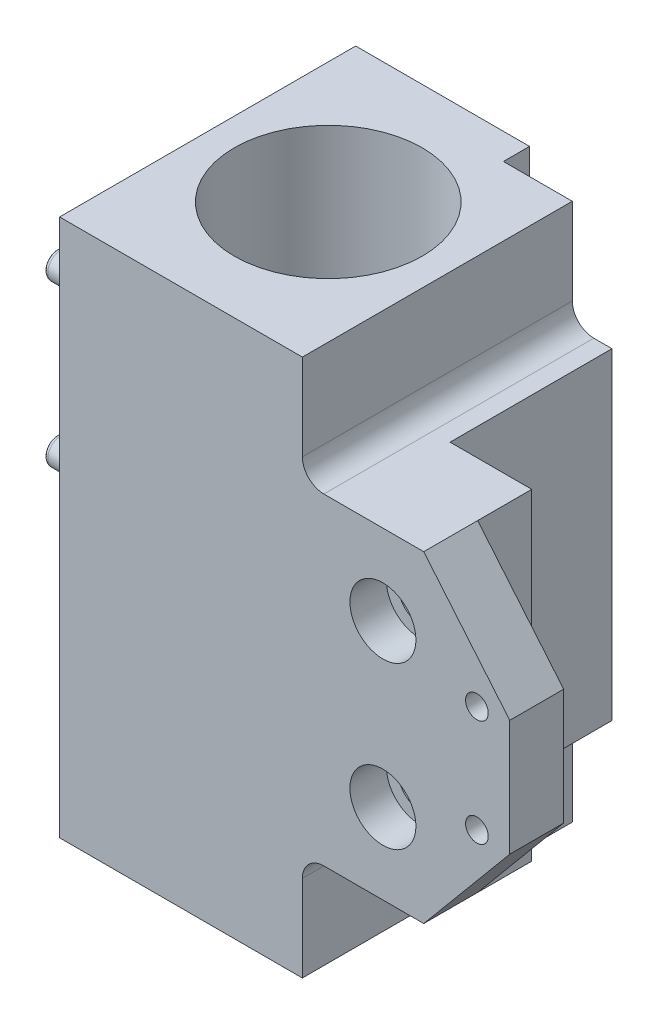
from build123d import *

# Parameters (mm, degrees)
BOSS_EXTRUDE1_DEPTH      = 31.765
BOSS_EXTRUDE1_DEPTH_BACK = 31.765
SKETCH1_R                = 11.1
SKETCH2_W                = 12.73
SKETCH2_H                = 38.12
BOSS_EXTRUDE2_DEPTH      = 9.43
CUT_EXTRUDE1_DEPTH       = 62.165032698
CHAMFER1_SIZE            = 1.6
SKETCH4_R                = 1.41
CUT_EXTRUDE2_DEPTH       = 11
SKETCH5_R                = 2.445
CUT_EXTRUDE3_DEPTH       = 55.875215034
SKETCH6_R                = 3.9
CUT_EXTRUDE4_DEPTH       = 4.32
SKETCH7_R                = 1.34
CUT_EXTRUDE5_DEPTH       = 58.75892074
SKETCH8_R                = 2
CUT_EXTRUDE6_DEPTH       = 10.5
SKETCH9_R                = 1.57
BOSS_EXTRUDE3_DEPTH      = 8.3
FILLET1_R                = 0.5


with BuildPart() as part:
    # Sketch1 → Boss-Extrude1 (new, two sides: drawn at the far end of the back side and taken through both)
    with BuildSketch(Plane(origin=(0, 0, 0), x_dir=(1, 0, 0), z_dir=(0, 1, 0)).offset(-BOSS_EXTRUDE1_DEPTH_BACK)):
        Polygon((-14.34, 17.58), (-14.34, -17.4), (38.84, -17.4), (38.84, -11.03), (28.68, -11.03), (28.68, -4.64), (19.03, -4.64), (19.03, 14.49), (14.34, 14.49), (6.2, 14.49), (6.2, 17.58), align=None)
        Circle(SKETCH1_R, mode=Mode.SUBTRACT)
    extrude(amount=BOSS_EXTRUDE1_DEPTH + BOSS_EXTRUDE1_DEPTH_BACK)

    # Sketch2 → Boss-Extrude2 (add)
    with BuildSketch(Plane.ZY.offset(14.34)):
        Rectangle(SKETCH2_W, SKETCH2_H)
    extrude(amount=BOSS_EXTRUDE2_DEPTH)

    # Sketch3 → Cut-Extrude1 (cut, through all)
    with BuildSketch(Plane(origin=(0, 0, -17.58), x_dir=(-1, 0, 0), z_dir=(0, 0, -1))):
        with BuildLine():
            Line((-38.84, 6.85), (-28.68, 19.025))
            Line((-28.68, 19.025), (-16.88, 19.025))
            ThreePointArc((-16.88, 19.025), (-15.083948776, 19.768948776), (-14.34, 21.565))
            Line((-14.34, 21.565), (-14.34, 31.765))
            Line((-14.34, 31.765), (-38.84, 31.765))
            Line((-38.84, 31.765), (-38.84, 6.85))
        make_face()
        with BuildLine():
            Line((-28.68, -19.025), (-16.88, -19.025))
            ThreePointArc((-16.88, -19.025), (-15.083948776, -19.768948776), (-14.34, -21.565))
            Line((-14.34, -21.565), (-14.34, -31.765))
            Line((-14.34, -31.765), (-38.84, -31.765))
            Line((-38.84, -31.765), (-38.84, -6.85))
            Line((-38.84, -6.85), (-28.68, -19.025))
        make_face()
    extrude(amount=-CUT_EXTRUDE1_DEPTH, mode=Mode.SUBTRACT)

    # Chamfer1
    chamfer1_edges = [part.edges().sort_by_distance(p)[0] for p in [
        (-23.77, -19.06, 0),
    ]]
    chamfer(chamfer1_edges, length=CHAMFER1_SIZE)

    # Sketch4 → Cut-Extrude2 (cut)
    with BuildSketch(Plane(origin=(0, 0, -14.49), x_dir=(-1, 0, 0), z_dir=(0, 0, -1))):
        with Locations((-12.48, 0)):
            Circle(SKETCH4_R)
    extrude(amount=-CUT_EXTRUDE2_DEPTH, mode=Mode.SUBTRACT)

    # Sketch5 → Cut-Extrude3 (cut, through all)
    with BuildSketch(Plane(origin=(0, 0, 4.64), x_dir=(-1, 0, 0), z_dir=(0, 0, -1))):
        with Locations((-23.855, -9.53)):
            Circle(SKETCH5_R)
        with Locations((-23.855, 9.53)):
            Circle(SKETCH5_R)
    extrude(amount=-CUT_EXTRUDE3_DEPTH, mode=Mode.SUBTRACT)

    # Sketch6 → Cut-Extrude4 (cut)
    with BuildSketch(Plane.XY.offset(17.4)):
        with Locations((23.855, -9.53)):
            Circle(SKETCH6_R)
        with Locations((23.855, 9.53)):
            Circle(SKETCH6_R)
    extrude(amount=-CUT_EXTRUDE4_DEPTH, mode=Mode.SUBTRACT)

    # Sketch7 → Cut-Extrude5 (cut, through all)
    with BuildSketch(Plane(origin=(0, 0, 11.03), x_dir=(-1, 0, 0), z_dir=(0, 0, -1))):
        with Locations((-34.96, 6.31)):
            Circle(SKETCH7_R)
        with Locations((-34.96, -6.31)):
            Circle(SKETCH7_R)
    extrude(amount=-CUT_EXTRUDE5_DEPTH, mode=Mode.SUBTRACT)

    # Sketch8 → Cut-Extrude6 (cut)
    with BuildSketch(Plane.ZY.offset(23.77)):
        Circle(SKETCH8_R)
    extrude(amount=-CUT_EXTRUDE6_DEPTH, mode=Mode.SUBTRACT)

    # Sketch9 → Boss-Extrude3 (add)
    with BuildSketch(Plane.ZY.offset(23.77)):
        with Locations((0, -9.505)):
            Circle(SKETCH9_R)
        with Locations((0, 9.505)):
            Circle(SKETCH9_R)
    extrude(amount=BOSS_EXTRUDE3_DEPTH)

    # Fillet1
    fillet1_edges = [part.edges().sort_by_distance(p)[0] for p in [
        (-32.07, 9.505, -1.57),
        (-32.07, -9.505, -1.57),
    ]]
    fillet(fillet1_edges, radius=FILLET1_R)


solid = part.part
